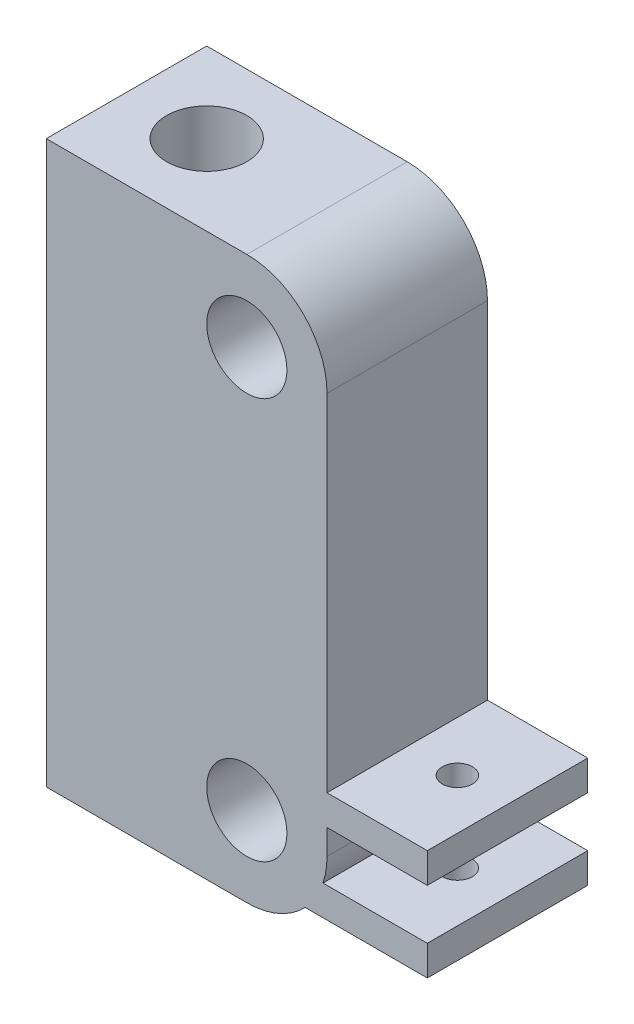
from build123d import *

# Parameters (mm, degrees)
SKETCH1_R           = 4
BOSS_EXTRUDE1_DEPTH = 16
SKETCH2_R           = 4
CUT_EXTRUDE1_DEPTH  = 63.237043653
SKETCH3_R           = 1.5
CUT_EXTRUDE2_DEPTH  = 51.435102881


with BuildPart() as part:
    # Sketch1 → Boss-Extrude1 (new body)
    with BuildSketch(Plane.XY):
        with BuildLine():
            Line((11.941959863, -20.868835105), (21.941959863, -20.868835105))
            Line((21.941959863, -20.868835105), (21.941959863, -23.868835105))
            Line((21.941959863, -23.868835105), (11.941959863, -23.868835105))
            Line((11.941959863, -23.868835105), (11.941959863, -26.368835105))
            ThreePointArc((11.941959863, -26.368835105), (11.841160348, -27.63478601), (11.541301939, -28.868835105))
            Line((11.541301939, -28.868835105), (21.941959863, -28.868835105))
            Line((21.941959863, -28.868835105), (21.941959863, -31.868835105))
            Line((21.941959863, -31.868835105), (9.751434882, -31.868835105))
            ThreePointArc((9.751434882, -31.868835105), (7.104237523, -33.717304334), (3.941959863, -34.368835105))
            Line((3.941959863, -34.368835105), (-16.058040137, -34.368835105))
            Line((-16.058040137, -34.368835105), (-16.058040137, 21.631164895))
            Line((-16.058040137, 21.631164895), (3.941959863, 21.631164895))
            ThreePointArc((3.941959863, 21.631164895), (9.598814112, 19.288019144), (11.941959863, 13.631164895))
            Line((11.941959863, 13.631164895), (11.941959863, -20.868835105))
        make_face()
        with Locations((3.941959863, 13.631164895)):
            Circle(SKETCH1_R, mode=Mode.SUBTRACT)
        with Locations((3.941959863, -26.368835105)):
            Circle(SKETCH1_R, mode=Mode.SUBTRACT)
    extrude(amount=-BOSS_EXTRUDE1_DEPTH)

    # Sketch2 → Cut-Extrude1 (cut, through all)
    with BuildSketch(Plane(origin=(0, 21.631164895, 0), x_dir=(1, 0, 0), z_dir=(0, 1, 0))):
        with Locations((-8.058040137, 8)):
            Circle(SKETCH2_R)
    extrude(amount=-CUT_EXTRUDE1_DEPTH, mode=Mode.SUBTRACT)

    # Sketch3 → Cut-Extrude2 (cut, through all)
    with BuildSketch(Plane(origin=(0, -20.868835105, 0), x_dir=(1, 0, 0), z_dir=(0, 1, 0))):
        with Locations((16.941959863, 8)):
            Circle(SKETCH3_R)
    extrude(amount=-CUT_EXTRUDE2_DEPTH, mode=Mode.SUBTRACT)


solid = part.part
